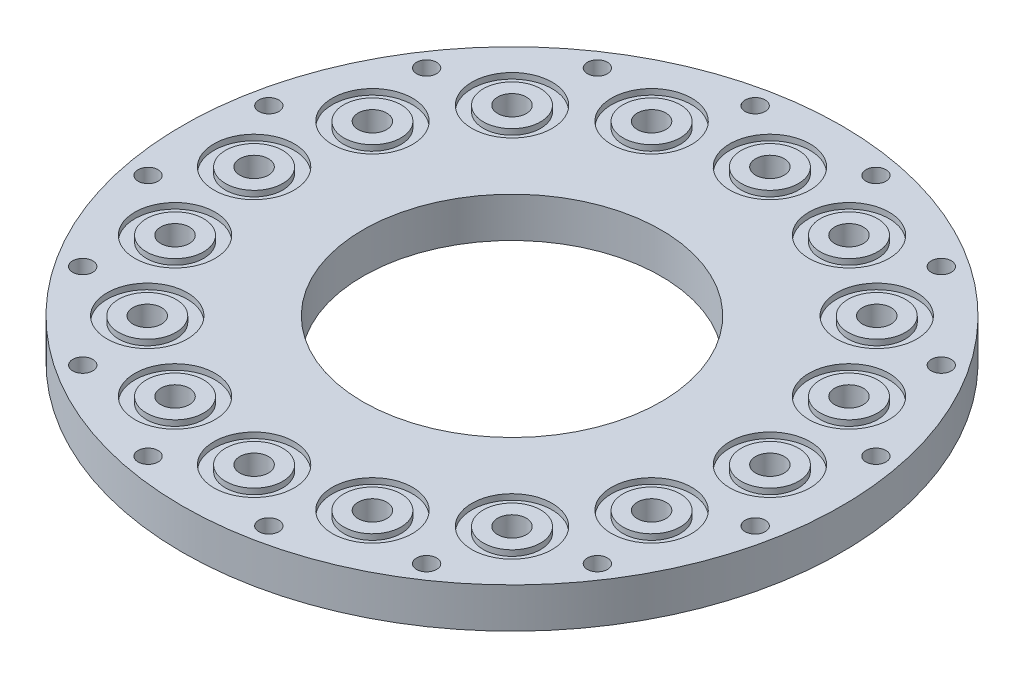
from build123d import *

# Parameters (mm, degrees)
SKETCH1_R           = 57.5
SKETCH1_R_2         = 1.75
SKETCH1_R_3         = 26
SKETCH1_R_4         = 2.5
BOSS_EXTRUDE1_DEPTH = 7
SKETCH2_R           = 7
SKETCH2_R_2         = 5
CUT_EXTRUDE1_DEPTH  = 1


with BuildPart() as part:
    # Sketch1 → Boss-Extrude1 (new body)
    with BuildSketch(Plane(origin=(0, 0, 0), x_dir=(1, 0, 0), z_dir=(0, 1, 0))):
        Circle(SKETCH1_R)
        with Locations((-10.534877389, 52.962405142)):
            Circle(SKETCH1_R_2, mode=Mode.SUBTRACT)
        with Locations((10.534877389, 52.962405142)):
            Circle(SKETCH1_R_2, mode=Mode.SUBTRACT)
        with Locations((30.000792583, 44.899359064)):
            Circle(SKETCH1_R_2, mode=Mode.SUBTRACT)
        with Locations((44.899359064, 30.000792583)):
            Circle(SKETCH1_R_2, mode=Mode.SUBTRACT)
        with Locations((52.962405142, 10.534877389)):
            Circle(SKETCH1_R_2, mode=Mode.SUBTRACT)
        with Locations((52.962405142, -10.534877389)):
            Circle(SKETCH1_R_2, mode=Mode.SUBTRACT)
        with Locations((44.899359064, -30.000792583)):
            Circle(SKETCH1_R_2, mode=Mode.SUBTRACT)
        with Locations((30.000792583, -44.899359064)):
            Circle(SKETCH1_R_2, mode=Mode.SUBTRACT)
        with Locations((10.534877389, -52.962405142)):
            Circle(SKETCH1_R_2, mode=Mode.SUBTRACT)
        with Locations((-10.534877389, -52.962405142)):
            Circle(SKETCH1_R_2, mode=Mode.SUBTRACT)
        with Locations((-30.000792583, -44.899359064)):
            Circle(SKETCH1_R_2, mode=Mode.SUBTRACT)
        with Locations((-44.899359064, -30.000792583)):
            Circle(SKETCH1_R_2, mode=Mode.SUBTRACT)
        Circle(SKETCH1_R_3, mode=Mode.SUBTRACT)
        with Locations((0, 45)):
            Circle(SKETCH1_R_4, mode=Mode.SUBTRACT)
        with Locations((17.220754456, 41.574578963)):
            Circle(SKETCH1_R_4, mode=Mode.SUBTRACT)
        with Locations((31.819805153, 31.819805153)):
            Circle(SKETCH1_R_4, mode=Mode.SUBTRACT)
        with Locations((41.574578963, 17.220754456)):
            Circle(SKETCH1_R_4, mode=Mode.SUBTRACT)
        with Locations((45, 0)):
            Circle(SKETCH1_R_4, mode=Mode.SUBTRACT)
        with Locations((41.574578963, -17.220754456)):
            Circle(SKETCH1_R_4, mode=Mode.SUBTRACT)
        with Locations((31.819805153, -31.819805153)):
            Circle(SKETCH1_R_4, mode=Mode.SUBTRACT)
        with Locations((17.220754456, -41.574578963)):
            Circle(SKETCH1_R_4, mode=Mode.SUBTRACT)
        with Locations((0, -45)):
            Circle(SKETCH1_R_4, mode=Mode.SUBTRACT)
        with Locations((-17.220754456, -41.574578963)):
            Circle(SKETCH1_R_4, mode=Mode.SUBTRACT)
        with Locations((-31.819805153, -31.819805153)):
            Circle(SKETCH1_R_4, mode=Mode.SUBTRACT)
        with Locations((-41.574578963, -17.220754456)):
            Circle(SKETCH1_R_4, mode=Mode.SUBTRACT)
        with Locations((-45, 0)):
            Circle(SKETCH1_R_4, mode=Mode.SUBTRACT)
        with Locations((-41.574578963, 17.220754456)):
            Circle(SKETCH1_R_4, mode=Mode.SUBTRACT)
        with Locations((-31.819805153, 31.819805153)):
            Circle(SKETCH1_R_4, mode=Mode.SUBTRACT)
        with Locations((-17.220754456, 41.574578963)):
            Circle(SKETCH1_R_4, mode=Mode.SUBTRACT)
        with Locations((-52.962405142, -10.534877389)):
            Circle(SKETCH1_R_2, mode=Mode.SUBTRACT)
        with Locations((-52.962405142, 10.534877389)):
            Circle(SKETCH1_R_2, mode=Mode.SUBTRACT)
        with Locations((-44.899359064, 30.000792583)):
            Circle(SKETCH1_R_2, mode=Mode.SUBTRACT)
        with Locations((-30.000792583, 44.899359064)):
            Circle(SKETCH1_R_2, mode=Mode.SUBTRACT)
    extrude(amount=BOSS_EXTRUDE1_DEPTH)

    # Sketch2 → Cut-Extrude1 (cut)
    # profile 1 of 16: a face of its own
    with BuildSketch(Plane(origin=(0, 7, 0), x_dir=(1, 0, 0), z_dir=(0, 1, 0))):
        with Locations((0, 45)):
            Circle(SKETCH2_R)
        with Locations((0, 45)):
            Circle(SKETCH2_R_2, mode=Mode.SUBTRACT)
    # profile 2 of 16: a face of its own
    with BuildSketch(Plane(origin=(0, 7, 0), x_dir=(1, 0, 0), z_dir=(0, 1, 0))):
        with Locations((17.220754456, 41.574578963)):
            Circle(SKETCH2_R)
        with Locations((17.220754456, 41.574578963)):
            Circle(SKETCH2_R_2, mode=Mode.SUBTRACT)
    # profile 3 of 16: a face of its own
    with BuildSketch(Plane(origin=(0, 7, 0), x_dir=(1, 0, 0), z_dir=(0, 1, 0))):
        with Locations((31.819805153, 31.819805153)):
            Circle(SKETCH2_R)
        with Locations((31.819805153, 31.819805153)):
            Circle(SKETCH2_R_2, mode=Mode.SUBTRACT)
    # profile 4 of 16: a face of its own
    with BuildSketch(Plane(origin=(0, 7, 0), x_dir=(1, 0, 0), z_dir=(0, 1, 0))):
        with Locations((41.574578963, 17.220754456)):
            Circle(SKETCH2_R)
        with Locations((41.574578963, 17.220754456)):
            Circle(SKETCH2_R_2, mode=Mode.SUBTRACT)
    # profile 5 of 16: a face of its own
    with BuildSketch(Plane(origin=(0, 7, 0), x_dir=(1, 0, 0), z_dir=(0, 1, 0))):
        with Locations((45, 0)):
            Circle(SKETCH2_R)
        with Locations((45, 0)):
            Circle(SKETCH2_R_2, mode=Mode.SUBTRACT)
    # profile 6 of 16: a face of its own
    with BuildSketch(Plane(origin=(0, 7, 0), x_dir=(1, 0, 0), z_dir=(0, 1, 0))):
        with Locations((41.574578963, -17.220754456)):
            Circle(SKETCH2_R)
        with Locations((41.574578963, -17.220754456)):
            Circle(SKETCH2_R_2, mode=Mode.SUBTRACT)
    # profile 7 of 16: a face of its own
    with BuildSketch(Plane(origin=(0, 7, 0), x_dir=(1, 0, 0), z_dir=(0, 1, 0))):
        with Locations((31.819805153, -31.819805153)):
            Circle(SKETCH2_R)
        with Locations((31.819805153, -31.819805153)):
            Circle(SKETCH2_R_2, mode=Mode.SUBTRACT)
    # profile 8 of 16: a face of its own
    with BuildSketch(Plane(origin=(0, 7, 0), x_dir=(1, 0, 0), z_dir=(0, 1, 0))):
        with Locations((17.220754456, -41.574578963)):
            Circle(SKETCH2_R)
        with Locations((17.220754456, -41.574578963)):
            Circle(SKETCH2_R_2, mode=Mode.SUBTRACT)
    # profile 9 of 16: a face of its own
    with BuildSketch(Plane(origin=(0, 7, 0), x_dir=(1, 0, 0), z_dir=(0, 1, 0))):
        with Locations((0, -45)):
            Circle(SKETCH2_R)
        with Locations((0, -45)):
            Circle(SKETCH2_R_2, mode=Mode.SUBTRACT)
    # profile 10 of 16: a face of its own
    with BuildSketch(Plane(origin=(0, 7, 0), x_dir=(1, 0, 0), z_dir=(0, 1, 0))):
        with Locations((-17.220754456, -41.574578963)):
            Circle(SKETCH2_R)
        with Locations((-17.220754456, -41.574578963)):
            Circle(SKETCH2_R_2, mode=Mode.SUBTRACT)
    # profile 11 of 16: a face of its own
    with BuildSketch(Plane(origin=(0, 7, 0), x_dir=(1, 0, 0), z_dir=(0, 1, 0))):
        with Locations((-31.819805153, -31.819805153)):
            Circle(SKETCH2_R)
        with Locations((-31.819805153, -31.819805153)):
            Circle(SKETCH2_R_2, mode=Mode.SUBTRACT)
    # profile 12 of 16: a face of its own
    with BuildSketch(Plane(origin=(0, 7, 0), x_dir=(1, 0, 0), z_dir=(0, 1, 0))):
        with Locations((-41.574578963, -17.220754456)):
            Circle(SKETCH2_R)
        with Locations((-41.574578963, -17.220754456)):
            Circle(SKETCH2_R_2, mode=Mode.SUBTRACT)
    # profile 13 of 16: a face of its own
    with BuildSketch(Plane(origin=(0, 7, 0), x_dir=(1, 0, 0), z_dir=(0, 1, 0))):
        with Locations((-45, 0)):
            Circle(SKETCH2_R)
        with Locations((-45, 0)):
            Circle(SKETCH2_R_2, mode=Mode.SUBTRACT)
    # profile 14 of 16: a face of its own
    with BuildSketch(Plane(origin=(0, 7, 0), x_dir=(1, 0, 0), z_dir=(0, 1, 0))):
        with Locations((-41.574578963, 17.220754456)):
            Circle(SKETCH2_R)
        with Locations((-41.574578963, 17.220754456)):
            Circle(SKETCH2_R_2, mode=Mode.SUBTRACT)
    # profile 15 of 16: a face of its own
    with BuildSketch(Plane(origin=(0, 7, 0), x_dir=(1, 0, 0), z_dir=(0, 1, 0))):
        with Locations((-31.819805153, 31.819805153)):
            Circle(SKETCH2_R)
        with Locations((-31.819805153, 31.819805153)):
            Circle(SKETCH2_R_2, mode=Mode.SUBTRACT)
    # profile 16 of 16: a face of its own
    with BuildSketch(Plane(origin=(0, 7, 0), x_dir=(1, 0, 0), z_dir=(0, 1, 0))):
        with Locations((-17.220754456, 41.574578963)):
            Circle(SKETCH2_R)
        with Locations((-17.220754456, 41.574578963)):
            Circle(SKETCH2_R_2, mode=Mode.SUBTRACT)
    extrude(amount=-CUT_EXTRUDE1_DEPTH, mode=Mode.SUBTRACT)


solid = part.part
